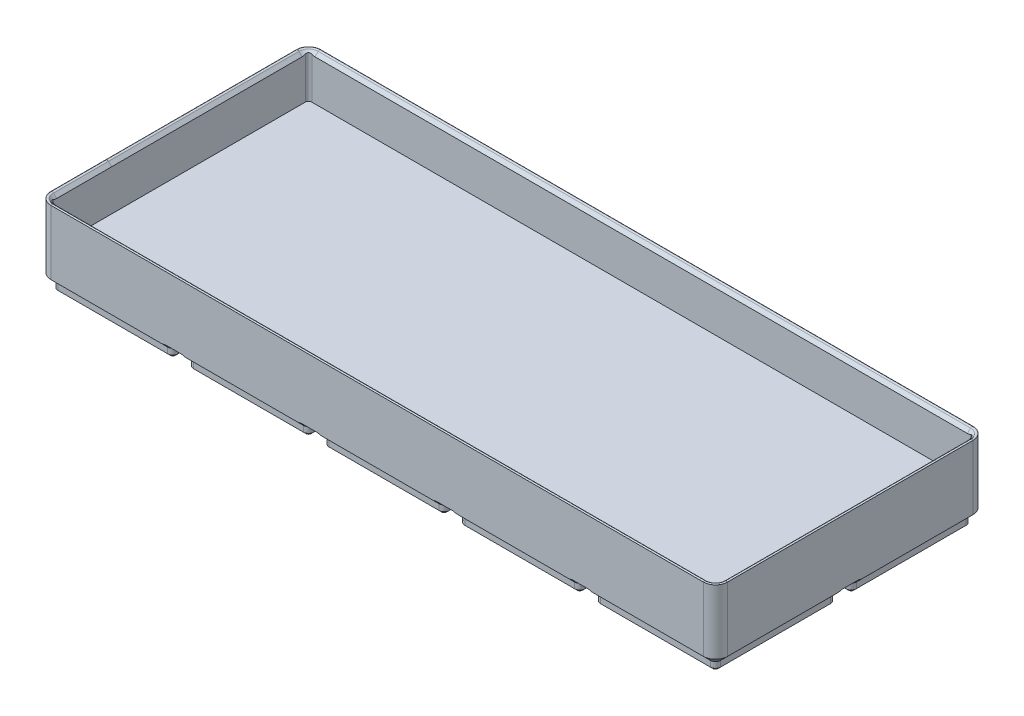
from build123d import *

# Parameters (mm, degrees)
BASE_DEPTH                          = 5
BOX_START                           = -84
BOX_OUTLINE_W                       = 210
BOX_OUTLINE_H                       = 16
BOX_DEPTH                           = 84
CORNER_FILLET_R                     = 4
BASE_CHAMFER_1_SIZE                 = 2.4
BASE_CHAMFER_2_SIZE                 = 0.8
BASE_PATTERN_COUNT                  = 2
BASE_PATTERN_PITCH                  = 42
BASE_PATTERN_COUNT_DIR2             = 5
BASE_PATTERN_PITCH_DIR2             = 42
BASE_CHAMFER_1_OF_BASE_PATTERN_SIZE = 2.4
BASE_CHAMFER_2_OF_BASE_PATTERN_SIZE = 0.8
INTERIOR_CUT_DEPTH                  = 13.8
TOP_EDGE_FILLET_R                   = 0.6
NESTING_CLEARANCE_CUT_DEPTH         = 228.532276445
BOSS_EXTRUDE1_START                 = 13.8
BOSS_EXTRUDE1_DEPTH                 = 13.8
CUT_EXTRUDE1_DEPTH                  = 227.826200115
CUT_EXTRUDE1_DEPTH_BACK             = 10


# Read off the part's stored shape, not the designer's step: Box
with BuildPart() as part:
    # Master → Base (new body)
    with BuildSketch(Plane(origin=(0, 0, 0), x_dir=(1, 0, 0), z_dir=(0, 1, 0))):
        with BuildLine():
            Line((4, 2.4), (38, 2.4))
            ThreePointArc((38, 2.4), (39.13137085, 2.86862915), (39.6, 4))
            Line((39.6, 4), (39.6, 38))
            ThreePointArc((39.6, 38), (39.13137085, 39.13137085), (38, 39.6))
            Line((38, 39.6), (4, 39.6))
            ThreePointArc((4, 39.6), (2.86862915, 39.13137085), (2.4, 38))
            Line((2.4, 38), (2.4, 4))
            ThreePointArc((2.4, 4), (2.86862915, 2.86862915), (4, 2.4))
        make_face()
    base = extrude(amount=-BASE_DEPTH)

    # Box outline → Box (add)
    with BuildSketch(Plane.XY.offset(BOX_START)):
        with Locations((105, 8)):
            Rectangle(BOX_OUTLINE_W, BOX_OUTLINE_H)
    extrude(amount=BOX_DEPTH)

    # Corner Fillet
    corner_fillet_edges = [part.edges().sort_by_distance(p)[0] for p in [
        (0, 8, 0),
        (210, 8, 0),
        (210, 8, -84),
        (0, 8, -84),
    ]]
    fillet(corner_fillet_edges, radius=CORNER_FILLET_R)

    # Base Chamfer 1
    base_chamfer_1_edges = [part.edges().sort_by_distance(p)[0] for p in [
        (21, 0, -39.6),
        (2.86862915, 0, -39.13137085),
        (2.4, 0, -21),
        (2.86862915, 0, -2.86862915),
        (21, 0, -2.4),
        (39.13137085, 0, -2.86862915),
        (39.6, 0, -21),
        (39.13137085, 0, -39.13137085),
    ]]
    chamfer(base_chamfer_1_edges, length=BASE_CHAMFER_1_SIZE - 0.0001)  # a hair under: the kernel refuses the full size

    # Base Chamfer 2
    base_chamfer_2_edges = [part.edges().sort_by_distance(p)[0] for p in [
        (2.86862915, -5, -39.13137085),
        (21, -5, -39.6),
        (39.13137085, -5, -39.13137085),
        (39.6, -5, -21),
        (39.13137085, -5, -2.86862915),
        (21, -5, -2.4),
        (2.86862915, -5, -2.86862915),
        (2.4, -5, -21),
    ]]
    chamfer(base_chamfer_2_edges, length=BASE_CHAMFER_2_SIZE)

    # Base Pattern: Base 2 × 5
    with Locations(*[(j * BASE_PATTERN_PITCH_DIR2, 0, -i * BASE_PATTERN_PITCH) for i in range(BASE_PATTERN_COUNT) for j in range(BASE_PATTERN_COUNT_DIR2) if (i, j) != (0, 0)]):
        add(base)

    # Base Chamfer 1 of Base Pattern
    base_chamfer_1_of_base_pattern_edges = [part.edges().sort_by_distance(p)[0] for p in [
        (63, 0, -39.6),
        (44.86862915, 0, -39.13137085),
        (44.4, 0, -21),
        (44.86862915, 0, -2.86862915),
        (63, 0, -2.4),
        (81.13137085, 0, -2.86862915),
        (81.6, 0, -21),
        (81.13137085, 0, -39.13137085),
        (105, 0, -39.6),
        (86.86862915, 0, -39.13137085),
        (86.4, 0, -21),
        (86.86862915, 0, -2.86862915),
        (105, 0, -2.4),
        (123.13137085, 0, -2.86862915),
        (123.6, 0, -21),
        (123.13137085, 0, -39.13137085),
        (147, 0, -39.6),
        (128.86862915, 0, -39.13137085),
        (128.4, 0, -21),
        (128.86862915, 0, -2.86862915),
        (147, 0, -2.4),
        (165.13137085, 0, -2.86862915),
        (165.6, 0, -21),
        (165.13137085, 0, -39.13137085),
        (189, 0, -39.6),
        (170.86862915, 0, -39.13137085),
        (170.4, 0, -21),
        (170.86862915, 0, -2.86862915),
        (189, 0, -2.4),
        (207.13137085, 0, -2.86862915),
        (207.6, 0, -21),
        (207.13137085, 0, -39.13137085),
        (21, 0, -81.6),
        (2.86862915, 0, -81.13137085),
        (2.4, 0, -63),
        (2.86862915, 0, -44.86862915),
        (21, 0, -44.4),
        (39.13137085, 0, -44.86862915),
        (39.6, 0, -63),
        (39.13137085, 0, -81.13137085),
        (63, 0, -81.6),
        (44.86862915, 0, -81.13137085),
        (44.4, 0, -63),
        (44.86862915, 0, -44.86862915),
        (63, 0, -44.4),
        (81.13137085, 0, -44.86862915),
        (81.6, 0, -63),
        (81.13137085, 0, -81.13137085),
        (105, 0, -81.6),
        (86.86862915, 0, -81.13137085),
        (86.4, 0, -63),
        (86.86862915, 0, -44.86862915),
        (105, 0, -44.4),
        (123.13137085, 0, -44.86862915),
        (123.6, 0, -63),
        (123.13137085, 0, -81.13137085),
        (147, 0, -81.6),
        (128.86862915, 0, -81.13137085),
        (128.4, 0, -63),
        (128.86862915, 0, -44.86862915),
        (147, 0, -44.4),
        (165.13137085, 0, -44.86862915),
        (165.6, 0, -63),
        (165.13137085, 0, -81.13137085),
        (189, 0, -81.6),
        (170.86862915, 0, -81.13137085),
        (170.4, 0, -63),
        (170.86862915, 0, -44.86862915),
        (189, 0, -44.4),
        (207.13137085, 0, -44.86862915),
        (207.6, 0, -63),
        (207.13137085, 0, -81.13137085),
    ]]
    chamfer(base_chamfer_1_of_base_pattern_edges, length=BASE_CHAMFER_1_OF_BASE_PATTERN_SIZE - 0.0001)  # a hair under: the kernel refuses the full size

    # Base Chamfer 2 of Base Pattern
    base_chamfer_2_of_base_pattern_edges = [part.edges().sort_by_distance(p)[0] for p in [
        (44.86862915, -5, -39.13137085),
        (63, -5, -39.6),
        (81.13137085, -5, -39.13137085),
        (81.6, -5, -21),
        (81.13137085, -5, -2.86862915),
        (63, -5, -2.4),
        (44.86862915, -5, -2.86862915),
        (44.4, -5, -21),
        (86.86862915, -5, -39.13137085),
        (105, -5, -39.6),
        (123.13137085, -5, -39.13137085),
        (123.6, -5, -21),
        (123.13137085, -5, -2.86862915),
        (105, -5, -2.4),
        (86.86862915, -5, -2.86862915),
        (86.4, -5, -21),
        (128.86862915, -5, -39.13137085),
        (147, -5, -39.6),
        (165.13137085, -5, -39.13137085),
        (165.6, -5, -21),
        (165.13137085, -5, -2.86862915),
        (147, -5, -2.4),
        (128.86862915, -5, -2.86862915),
        (128.4, -5, -21),
        (170.86862915, -5, -39.13137085),
        (189, -5, -39.6),
        (207.13137085, -5, -39.13137085),
        (207.6, -5, -21),
        (207.13137085, -5, -2.86862915),
        (189, -5, -2.4),
        (170.86862915, -5, -2.86862915),
        (170.4, -5, -21),
        (2.86862915, -5, -81.13137085),
        (21, -5, -81.6),
        (39.13137085, -5, -81.13137085),
        (39.6, -5, -63),
        (39.13137085, -5, -44.86862915),
        (21, -5, -44.4),
        (2.86862915, -5, -44.86862915),
        (2.4, -5, -63),
        (44.86862915, -5, -81.13137085),
        (63, -5, -81.6),
        (81.13137085, -5, -81.13137085),
        (81.6, -5, -63),
        (81.13137085, -5, -44.86862915),
        (63, -5, -44.4),
        (44.86862915, -5, -44.86862915),
        (44.4, -5, -63),
        (86.86862915, -5, -81.13137085),
        (105, -5, -81.6),
        (123.13137085, -5, -81.13137085),
        (123.6, -5, -63),
        (123.13137085, -5, -44.86862915),
        (105, -5, -44.4),
        (86.86862915, -5, -44.86862915),
        (86.4, -5, -63),
        (128.86862915, -5, -81.13137085),
        (147, -5, -81.6),
        (165.13137085, -5, -81.13137085),
        (165.6, -5, -63),
        (165.13137085, -5, -44.86862915),
        (147, -5, -44.4),
        (128.86862915, -5, -44.86862915),
        (128.4, -5, -63),
        (170.86862915, -5, -81.13137085),
        (189, -5, -81.6),
        (207.13137085, -5, -81.13137085),
        (207.6, -5, -63),
        (207.13137085, -5, -44.86862915),
        (189, -5, -44.4),
        (170.86862915, -5, -44.86862915),
        (170.4, -5, -63),
    ]]
    chamfer(base_chamfer_2_of_base_pattern_edges, length=BASE_CHAMFER_2_OF_BASE_PATTERN_SIZE)

    # Top Nesting Feature: sweep along a path in Sketch5
    with BuildLine(Plane(origin=(0, 16, 0), x_dir=(1, 0, 0), z_dir=(0, 1, 0))) as top_nesting_feature_path:
        Line((4, 0), (206, 0))
        ThreePointArc((206, 0), (208.828427125, 1.171572875), (210, 4))
        Line((210, 4), (210, 80))
        ThreePointArc((210, 80), (208.828427125, 82.828427125), (206, 84))
        Line((206, 84), (4, 84))
        ThreePointArc((4, 84), (1.171572875, 82.828427125), (0, 80))
        Line((0, 80), (0, 4))
        ThreePointArc((0, 4), (1.171572875, 1.171572875), (4, 0))
    # Sketch4 → Top Nesting Feature (sweep)
    with BuildSketch(Plane(origin=(0, 0, -21), x_dir=(-1, 0, 0), z_dir=(0, 0, -1))):
        Polygon((0, 16), (0, 20.646446609), (-2.15, 18.496446609), (-2.15, 16.696446609), (-2.846446609, 16), align=None)
    sweep(path=top_nesting_feature_path.line)

    # Sketch6 → Interior Cut (cut)
    with BuildSketch(Plane(origin=(0, 16, 0), x_dir=(1, 0, 0), z_dir=(0, 1, 0))):
        with BuildLine():
            Line((2.846446609, 80), (2.846446609, 21))
            Line((2.846446609, 21), (2.846446609, 4))
            ThreePointArc((2.846446609, 4), (3.184314575, 3.184314575), (4, 2.846446609))
            Line((4, 2.846446609), (206, 2.846446609))
            ThreePointArc((206, 2.846446609), (206.815685425, 3.184314575), (207.153553391, 4))
            Line((207.153553391, 4), (207.153553391, 80))
            ThreePointArc((207.153553391, 80), (206.815685425, 80.815685425), (206, 81.153553391))
            Line((206, 81.153553391), (4, 81.153553391))
            ThreePointArc((4, 81.153553391), (3.184314575, 80.815685425), (2.846446609, 80))
        make_face()
    extrude(amount=-INTERIOR_CUT_DEPTH, mode=Mode.SUBTRACT)

    # Interior Sweep: sweep along a path in Sketch7
    with BuildLine(Plane(origin=(0, 2.2, 0), x_dir=(1, 0, 0), z_dir=(0, 1, 0))) as interior_sweep_path:
        Line((4, 1.2), (206, 1.2))
        ThreePointArc((206, 1.2), (207.979898987, 2.020101013), (208.8, 4))
        Line((208.8, 4), (208.8, 80))
        ThreePointArc((208.8, 80), (207.979898987, 81.979898987), (206, 82.8))
        Line((206, 82.8), (4, 82.8))
        ThreePointArc((4, 82.8), (2.020101013, 81.979898987), (1.2, 80))
        Line((1.2, 80), (1.2, 4))
        ThreePointArc((1.2, 4), (2.020101013, 2.020101013), (4, 1.2))
    # Sketch8 → Interior Sweep (sweep, cut)
    with BuildSketch(Plane(origin=(0, 0, -21), x_dir=(-1, 0, 0), z_dir=(0, 0, -1))):
        Polygon((-2.846446609, 14.8), (-1.45, 13.403553391), (-1.45, 2.2), (-2.846446609, 2.2), align=None)
    sweep(path=interior_sweep_path.line, mode=Mode.SUBTRACT)

    # Top Edge Fillet
    top_edge_fillet_edges = [part.edges().sort_by_distance(p)[0] for p in [
        (0, 20.646446609, -42),
        (1.171572875, 20.646446609, -1.171572875),
        (105, 20.646446609, 0),
        (208.828427125, 20.646446609, -1.171572875),
        (210, 20.646446609, -42),
        (208.828427125, 20.646446609, -82.828427125),
        (105, 20.646446609, -84),
        (1.171572875, 20.646446609, -82.828427125),
        (0, 20.646446609, -42),
    ]]
    fillet(top_edge_fillet_edges, radius=TOP_EDGE_FILLET_R)

    # Sketch14 → Nesting Clearance Cut (cut, through all)
    with BuildSketch(Plane.XZ.offset(5)):
        with BuildLine():
            Line((-1, -4), (-1, -80))
            ThreePointArc((-1, -80), (0.464466094, -83.535533906), (4, -85))
            Line((4, -85), (206, -85))
            ThreePointArc((206, -85), (209.535533906, -83.535533906), (211, -80))
            Line((211, -80), (211, -4))
            ThreePointArc((211, -4), (209.535533906, -0.464466094), (206, 1))
            Line((206, 1), (4, 1))
            ThreePointArc((4, 1), (0.464466094, -0.464466094), (-1, -4))
        make_face()
        with BuildLine():
            Line((0.25, -4), (0.25, -80))
            ThreePointArc((0.25, -80), (1.348349571, -82.651650429), (4, -83.75))
            Line((4, -83.75), (206, -83.75))
            ThreePointArc((206, -83.75), (208.651650429, -82.651650429), (209.75, -80))
            Line((209.75, -80), (209.75, -4))
            ThreePointArc((209.75, -4), (208.651650429, -1.348349571), (206, -0.25))
            Line((206, -0.25), (4, -0.25))
            ThreePointArc((4, -0.25), (1.348349571, -1.348349571), (0.25, -4))
        make_face(mode=Mode.SUBTRACT)
    extrude(amount=-NESTING_CLEARANCE_CUT_DEPTH, mode=Mode.SUBTRACT)

    # Sketch15 → Boss-Extrude1 (add)
    with BuildSketch(Plane(origin=(0, 2.2, 0), x_dir=(1, 0, 0), z_dir=(0, 1, 0)).offset(BOSS_EXTRUDE1_START)):
        with BuildLine():
            Line((208.55, 4), (208.55, 80))
            ThreePointArc((208.55, 80), (207.803122292, 81.803122292), (206, 82.55))
            Line((206, 82.55), (4, 82.55))
            ThreePointArc((4, 82.55), (2.196877708, 81.803122292), (1.45, 80))
            Line((1.45, 80), (1.45, 21))
            Line((1.45, 21), (1.45, 4))
            ThreePointArc((1.45, 4), (2.196877708, 2.196877708), (4, 1.45))
            Line((4, 1.45), (206, 1.45))
            ThreePointArc((206, 1.45), (207.803122292, 2.196877708), (208.55, 4))
        make_face()
    extrude(amount=-BOSS_EXTRUDE1_DEPTH)

    # Sketch16 → Cut-Extrude1 (cut, two sides: drawn at the far end of the back side and taken through both)
    with BuildSketch(Plane(origin=(0, 16, 0), x_dir=(1, 0, 0), z_dir=(0, 1, 0)).offset(-CUT_EXTRUDE1_DEPTH_BACK)):
        with BuildLine():
            Line((3, 2), (207, 2))
            ThreePointArc((207, 2), (207.707106781, 2.292893219), (208, 3))
            Line((208, 3), (208, 81))
            ThreePointArc((208, 81), (207.707106781, 81.707106781), (207, 82))
            Line((207, 82), (3, 82))
            ThreePointArc((3, 82), (2.292893219, 81.707106781), (2, 81))
            Line((2, 81), (2, 3))
            ThreePointArc((2, 3), (2.292893219, 2.292893219), (3, 2))
        make_face()
    extrude(amount=CUT_EXTRUDE1_DEPTH + CUT_EXTRUDE1_DEPTH_BACK, mode=Mode.SUBTRACT)


solid = part.part
